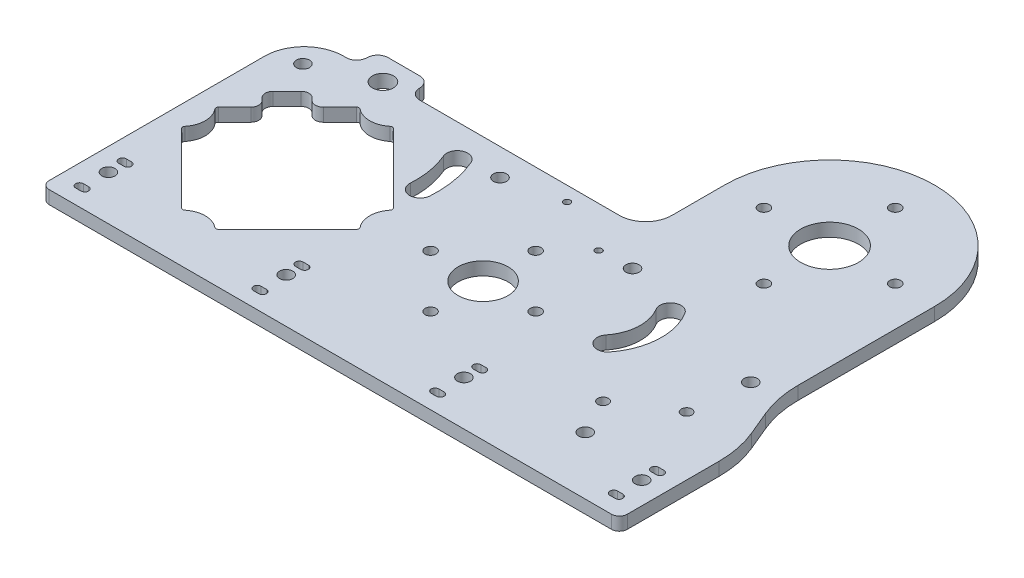
from build123d import *

# Parameters (mm, degrees)
SKETCH1_R           = 2.1
SKETCH1_R_2         = 2.5
SKETCH1_R_3         = 2
SKETCH1_R_4         = 9.5
SKETCH1_R_5         = 1.25
SKETCH1_R_6         = 11
BOSS_EXTRUDE1_DEPTH = 5
SKETCH18_R          = 2.5
CUT_EXTRUDE15_DEPTH = 483.844656179
FILLET2_R           = 40
FILLET3_R           = 40
SKETCH21_W          = 20
SKETCH21_H          = 8
BOSS_EXTRUDE3_DEPTH = 5
SKETCH20_R          = 4
CUT_EXTRUDE17_DEPTH = 279.07373123
FILLET5_R           = 1
FILLET6_R           = 3
FILLET7_R           = 4
FILLET8_R           = 3


with BuildPart() as part:
    # Sketch1 → Boss-Extrude1 (new body)
    with BuildSketch(Plane(origin=(0, 0, 0), x_dir=(1, 0, 0), z_dir=(0, 1, 0))):
        with BuildLine():
            Line((0, 85), (0, 0))
            Line((0, 0), (220, 0))
            Line((220, 0), (220, 46))
            Line((220, 46), (210, 70))
            Line((210, 70), (210, 130))
            ThreePointArc((210, 130), (170, 170), (130, 130))
            Line((130, 130), (130, 110))
            ThreePointArc((130, 110), (127.071067812, 102.928932188), (120, 100))
            Line((120, 100), (15, 100))
            ThreePointArc((15, 100), (4.393398282, 95.606601718), (0, 85))
        make_face()
        with BuildLine():
            ThreePointArc((7.358874503, 46.014988345), (9.994913472, 52.378949376), (7.358874503, 58.742910407))
            Line((7.358874503, 58.742910407), (16.298524283, 67.682560186))
            Line((16.298524283, 67.682560186), (11.09053907, 72.890545399))
            Line((11.09053907, 72.890545399), (20.624322085, 82.424328414))
            Line((20.624322085, 82.424328414), (25.832307298, 77.216343201))
            Line((25.832307298, 77.216343201), (34.936038969, 86.320074873))
            ThreePointArc((34.936038969, 86.320074873), (41.3, 83.684035903), (47.663961031, 86.320074873))
            Line((47.663961031, 86.320074873), (75.241125497, 58.742910407))
            ThreePointArc((75.241125497, 58.742910407), (72.605086528, 52.378949376), (75.241125497, 46.014988345))
            Line((75.241125497, 46.014988345), (47.663961031, 18.437823879))
            ThreePointArc((47.663961031, 18.437823879), (41.3, 21.073862848), (34.936038969, 18.437823879))
            Line((34.936038969, 18.437823879), (7.358874503, 46.014988345))
        make_face(mode=Mode.SUBTRACT)
        with Locations(Location((95.75, 52.378949376, 0), (0, 0, 270))):
            Circle(SKETCH1_R, mode=Mode.SUBTRACT)
        with BuildLine():
            ThreePointArc((77.543356768, 70.375048681), (73.293969574, 66.641055044), (69.559975938, 70.890442238))
            ThreePointArc((69.559975938, 70.890442238), (69.148853816, 78.646273201), (66.944221963, 86.093523278))
            ThreePointArc((66.944221963, 86.093523278), (69.043291634, 91.346513523), (74.296281879, 89.247443853))
            ThreePointArc((74.296281879, 89.247443853), (77.033008956, 80.00277522), (77.543356768, 70.375048681))
        make_face(mode=Mode.SUBTRACT)
        with Locations(Location((115.75, 32.378949376, 0), (0, 0, 270))):
            Circle(SKETCH1_R, mode=Mode.SUBTRACT)
        with Locations(Location((185, 22, 0), (0, 0, 270))):
            Circle(SKETCH1_R_2, mode=Mode.SUBTRACT)
        with Locations(Location((178.187043017, 35.611788831, 0), (0, 0, 270))):
            Circle(SKETCH1_R_3, mode=Mode.SUBTRACT)
        with Locations(Location((115.75, 52.378949376, 0), (0, 0, 270))):
            Circle(SKETCH1_R_4, mode=Mode.SUBTRACT)
        with Locations(Location((135.75, 52.378949376, 0), (0, 0, 270))):
            Circle(SKETCH1_R, mode=Mode.SUBTRACT)
        with Locations(Location((115.75, 72.378949376, 0), (0, 0, 270))):
            Circle(SKETCH1_R, mode=Mode.SUBTRACT)
        with Locations(Location((127.63485968, 84.474011316, 0), (0, 0, 270))):
            Circle(SKETCH1_R_5, mode=Mode.SUBTRACT)
        with BuildLine():
            ThreePointArc((157.94568485, 75.987049461), (159.277720174, 81.48483828), (164.775508993, 80.152802956))
            ThreePointArc((164.775508993, 80.152802956), (168.201540304, 66.369956658), (163.138904601, 53.100658923))
            ThreePointArc((163.138904601, 53.100658923), (157.520629535, 52.441124786), (156.861095398, 58.059399852))
            ThreePointArc((156.861095398, 58.059399852), (160.216140338, 66.853058501), (157.94568485, 75.987049461))
        make_face(mode=Mode.SUBTRACT)
        with Locations(Location((197.592337166, 48, 0), (0, 0, 270))):
            Circle(SKETCH1_R_3, mode=Mode.SUBTRACT)
        with Locations(Location((200, 70, 0), (0, 0, 270))):
            Circle(SKETCH1_R_2, mode=Mode.SUBTRACT)
        with Locations(Location((9.83558927, 89.725342507, 0), (0, 0, 270))):
            Circle(SKETCH1_R_2, mode=Mode.SUBTRACT)
        with Locations(Location((84.83558927, 89.725342507, 0), (0, 0, 270))):
            Circle(SKETCH1_R_2, mode=Mode.SUBTRACT)
        with Locations(Location((105.63485968, 94.474011316, 0), (0, 0, 270))):
            Circle(SKETCH1_R_5, mode=Mode.SUBTRACT)
        with Locations(Location((140, 85, 0), (0, 0, 270))):
            Circle(SKETCH1_R_2, mode=Mode.SUBTRACT)
        with Locations(Location((170, 105, 0), (0, 0, 270))):
            Circle(SKETCH1_R, mode=Mode.SUBTRACT)
        with Locations(Location((145, 130, 0), (0, 0, 270))):
            Circle(SKETCH1_R, mode=Mode.SUBTRACT)
        with Locations(Location((170, 130, 0), (0, 0, 270))):
            Circle(SKETCH1_R_6, mode=Mode.SUBTRACT)
        with Locations(Location((195, 130, 0), (0, 0, 270))):
            Circle(SKETCH1_R, mode=Mode.SUBTRACT)
        with Locations(Location((170, 155, 0), (0, 0, 270))):
            Circle(SKETCH1_R, mode=Mode.SUBTRACT)
    extrude(amount=BOSS_EXTRUDE1_DEPTH)

    # Sketch18 → Cut-Extrude15 (cut, through all)
    with BuildSketch(Plane(origin=(300.638016231, 0, 207.797227621), x_dir=(-1, 0, 0), z_dir=(0, -1, 0))):
        with Locations(Location((292.118016257, 224.797227621, 0), (0, 0, 90))):
            Circle(SKETCH18_R)
        with Locations(Location((224.458016257, 224.797227621, 0), (0, 0, 90))):
            Circle(SKETCH18_R)
        with Locations(Location((156.798016257, 224.797227621, 0), (0, 0, 90))):
            Circle(SKETCH18_R)
        with Locations(Location((89.138016257, 224.797227621, 0), (0, 0, 90))):
            Circle(SKETCH18_R)
        with BuildLine():
            Line((293.118016257, 229.697227621), (291.118016257, 229.697227621))
            ThreePointArc((291.118016257, 229.697227621), (289.668016257, 231.147227621), (291.118016257, 232.597227621))
            Line((291.118016257, 232.597227621), (293.118016257, 232.597227621))
            ThreePointArc((293.118016257, 232.597227621), (294.568016257, 231.147227621), (293.118016257, 229.697227621))
        make_face()
        with BuildLine():
            Line((293.118016257, 213.347227621), (291.118016257, 213.347227621))
            ThreePointArc((291.118016257, 213.347227621), (289.668016257, 214.797227621), (291.118016257, 216.247227621))
            Line((291.118016257, 216.247227621), (293.118016257, 216.247227621))
            ThreePointArc((293.118016257, 216.247227621), (294.568016257, 214.797227621), (293.118016257, 213.347227621))
        make_face()
        with BuildLine():
            Line((225.458016257, 229.347227621), (223.458016257, 229.347227621))
            ThreePointArc((223.458016257, 229.347227621), (222.008016257, 230.797227621), (223.458016257, 232.247227621))
            Line((223.458016257, 232.247227621), (225.458016257, 232.247227621))
            ThreePointArc((225.458016257, 232.247227621), (226.908016257, 230.797227621), (225.458016257, 229.347227621))
        make_face()
        with BuildLine():
            Line((225.458016257, 213.347227621), (223.458016257, 213.347227621))
            ThreePointArc((223.458016257, 213.347227621), (222.008016257, 214.797227621), (223.458016257, 216.247227621))
            Line((223.458016257, 216.247227621), (225.458016257, 216.247227621))
            ThreePointArc((225.458016257, 216.247227621), (226.908016257, 214.797227621), (225.458016257, 213.347227621))
        make_face()
        with BuildLine():
            Line((157.798016257, 229.347227621), (155.798016257, 229.347227621))
            ThreePointArc((155.798016257, 229.347227621), (154.348016257, 230.797227621), (155.798016257, 232.247227621))
            Line((155.798016257, 232.247227621), (157.798016257, 232.247227621))
            ThreePointArc((157.798016257, 232.247227621), (159.248016257, 230.797227621), (157.798016257, 229.347227621))
        make_face()
        with BuildLine():
            Line((157.798016257, 213.347227621), (155.798016257, 213.347227621))
            ThreePointArc((155.798016257, 213.347227621), (154.348016257, 214.797227621), (155.798016257, 216.247227621))
            Line((155.798016257, 216.247227621), (157.798016257, 216.247227621))
            ThreePointArc((157.798016257, 216.247227621), (159.248016257, 214.797227621), (157.798016257, 213.347227621))
        make_face()
        with BuildLine():
            Line((90.138016257, 229.347227621), (88.138016257, 229.347227621))
            ThreePointArc((88.138016257, 229.347227621), (86.688016257, 230.797227621), (88.138016257, 232.247227621))
            Line((88.138016257, 232.247227621), (90.138016257, 232.247227621))
            ThreePointArc((90.138016257, 232.247227621), (91.588016257, 230.797227621), (90.138016257, 229.347227621))
        make_face()
        with BuildLine():
            Line((90.138016257, 213.697227621), (88.138016257, 213.697227621))
            ThreePointArc((88.138016257, 213.697227621), (86.688016257, 215.147227621), (88.138016257, 216.597227621))
            Line((88.138016257, 216.597227621), (90.138016257, 216.597227621))
            ThreePointArc((90.138016257, 216.597227621), (91.588016257, 215.147227621), (90.138016257, 213.697227621))
        make_face()
    extrude(amount=-CUT_EXTRUDE15_DEPTH, mode=Mode.SUBTRACT)

    # Fillet2
    fillet2_edges = [part.edges().sort_by_distance(p)[0] for p in [
        (210, 2.5, -70),
    ]]
    fillet(fillet2_edges, radius=FILLET2_R)

    # Fillet3
    fillet3_edges = [part.edges().sort_by_distance(p)[0] for p in [
        (220, 2.5, -46),
    ]]
    fillet(fillet3_edges, radius=FILLET3_R)

    # Sketch21 → Boss-Extrude3 (add)
    with BuildSketch(Plane(origin=(0, 5, 0), x_dir=(1, 0, 0), z_dir=(0, 1, 0))):
        with Locations((30, 104)):
            Rectangle(SKETCH21_W, SKETCH21_H)
    extrude(amount=-BOSS_EXTRUDE3_DEPTH)

    # Sketch20 → Cut-Extrude17 (cut, through all)
    with BuildSketch(Plane(origin=(0, 0, 0), x_dir=(-1, 0, 0), z_dir=(0, -1, 0))):
        with Locations(Location((-31, 99, 0), (0, 0, 90))):
            Circle(SKETCH20_R)
    extrude(amount=-CUT_EXTRUDE17_DEPTH, mode=Mode.SUBTRACT)

    # Fillet5
    fillet5_edges = [part.edges().sort_by_distance(p)[0] for p in [
        (75.241125497, 2.5, -46.014988345),
        (75.241125497, 2.5, -58.742910407),
        (47.663961031, 2.5, -86.320074873),
        (34.936038969, 2.5, -86.320074873),
        (7.358874503, 2.5, -58.742910407),
        (7.358874503, 2.5, -46.014988345),
        (34.936038969, 2.5, -18.437823879),
        (47.663961031, 2.5, -18.437823879),
    ]]
    fillet(fillet5_edges, radius=FILLET5_R)

    # Fillet6
    fillet6_edges = [part.edges().sort_by_distance(p)[0] for p in [
        (25.832307298, 2.5, -77.216343201),
        (20.624322085, 2.5, -82.424328414),
        (11.09053907, 2.5, -72.890545399),
        (16.298524283, 2.5, -67.682560186),
    ]]
    fillet(fillet6_edges, radius=FILLET6_R)

    # Fillet7
    fillet7_edges = [part.edges().sort_by_distance(p)[0] for p in [
        (40, 2.5, -100),
        (20, 2.5, -100),
    ]]
    fillet(fillet7_edges, radius=FILLET7_R)
    fillet7_2_edges = [part.edges().sort_by_distance(p)[0] for p in [
        (40, 2.5, -108),
        (20, 2.5, -108),
    ]]
    fillet(fillet7_2_edges, radius=FILLET7_R - 0.0001)  # a hair under: the kernel refuses the full size

    # Fillet8
    fillet8_edges = [part.edges().sort_by_distance(p)[0] for p in [
        (220, 2.5, 0),
        (0, 2.5, 0),
    ]]
    fillet(fillet8_edges, radius=FILLET8_R)


solid = part.part
